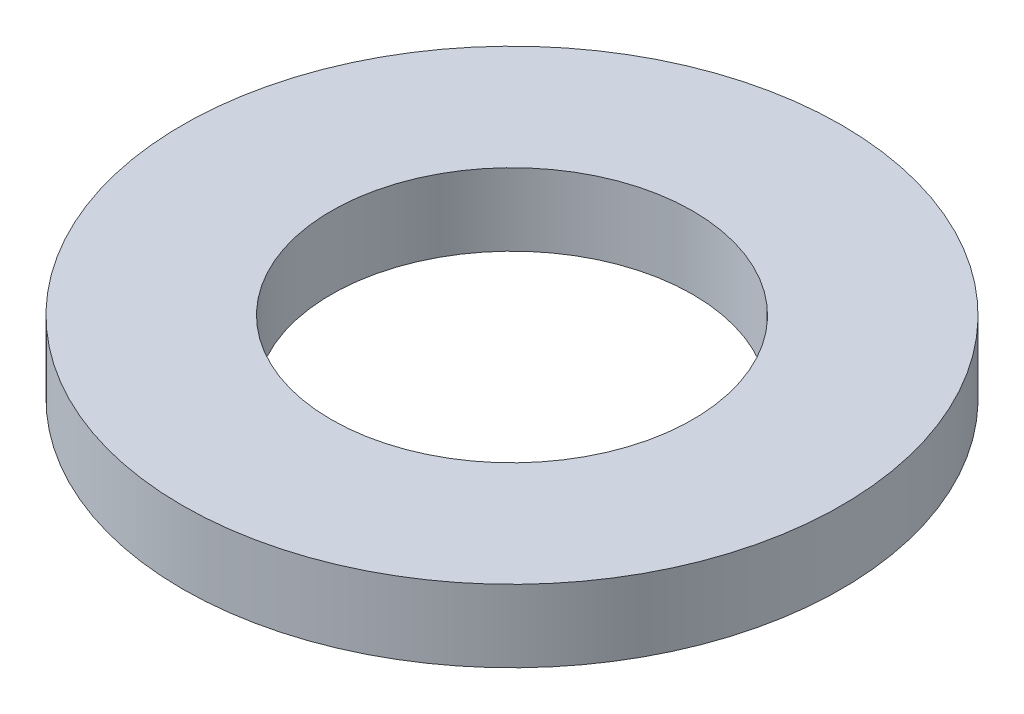
from build123d import *

# Parameters (mm, degrees)
SKETCH1_R           = 77.5
BOSS_EXTRUDE1_DEPTH = 17
SKETCH2_R           = 42.5
CUT_EXTRUDE1_DEPTH  = 111.91212738


with BuildPart() as part:
    # Sketch1 → Boss-Extrude1 (new body)
    with BuildSketch(Plane(origin=(0, 0, 0), x_dir=(1, 0, 0), z_dir=(0, 1, 0))):
        Circle(SKETCH1_R)
    extrude(amount=BOSS_EXTRUDE1_DEPTH)

    # Sketch2 → Cut-Extrude1 (cut, through all)
    with BuildSketch(Plane(origin=(0, 0, 0), x_dir=(1, 0, 0), z_dir=(0, 1, 0))):
        Circle(SKETCH2_R)
    extrude(amount=CUT_EXTRUDE1_DEPTH, mode=Mode.SUBTRACT)


solid = part.part
